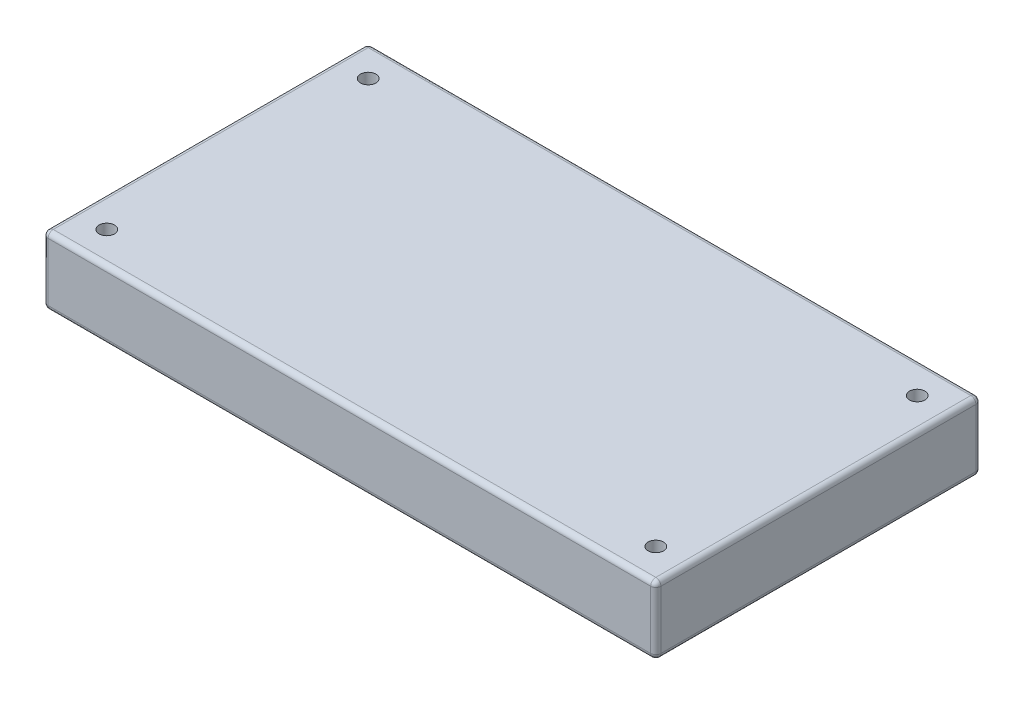
from build123d import *

# Parameters (mm, degrees)
SKETCH_1_W          = 119.1
SKETCH_1_H          = 63.2
EXTRUDE_1_DEPTH     = 13.3
SKETCH_2_R          = 1.5
CUT_EXTRUDE_1_DEPTH = 13.3
SKETCH_3_R          = 1.5
CUT_EXTRUDE_2_DEPTH = 13.3
SKETCH_4_R          = 1.5
CUT_EXTRUDE_3_DEPTH = 13.3
SKETCH_5_R          = 1.5
CUT_EXTRUDE_4_DEPTH = 13.3
SKETCH_7_R          = 0.25
EXTRUDE_4_DEPTH     = 2.65
SKETCH_8_R          = 0.25
EXTRUDE_5_DEPTH     = 2.65
SKETCH_9_R          = 0.25
EXTRUDE_6_DEPTH     = 2.65
SKETCH_10_R         = 1
SKETCH_10_R_2       = 0.5
EXTRUDE_7_DEPTH     = 2.65
FILLET_1_R          = 1
FILLET_2_R          = 1


with BuildPart() as part:
    # 草图1 → 凸台-拉伸1 (new body)
    with BuildSketch(Plane(origin=(0, 0, 0), x_dir=(1, 0, 0), z_dir=(0, 1, 0))):
        Rectangle(SKETCH_1_W, SKETCH_1_H)
    extrude(amount=EXTRUDE_1_DEPTH)

    # 草图2 → 切除-拉伸1 (cut)
    with BuildSketch(Plane(origin=(0, 13.3, 0), x_dir=(1, 0, 0), z_dir=(0, 1, 0))):
        with Locations(Location((-53.35, 25.4, 0), (0, 0, 270))):
            Circle(SKETCH_2_R)
    extrude(amount=-CUT_EXTRUDE_1_DEPTH, mode=Mode.SUBTRACT)

    # 草图3 → 切除-拉伸2 (cut)
    with BuildSketch(Plane(origin=(0, 13.3, 0), x_dir=(1, 0, 0), z_dir=(0, 1, 0))):
        with Locations(Location((53.35, 25.4, 0), (0, 0, 270))):
            Circle(SKETCH_3_R)
    extrude(amount=-CUT_EXTRUDE_2_DEPTH, mode=Mode.SUBTRACT)

    # 草图4 → 切除-拉伸3 (cut)
    with BuildSketch(Plane(origin=(0, 13.3, 0), x_dir=(1, 0, 0), z_dir=(0, 1, 0))):
        with Locations(Location((-53.35, -25.4, 0), (0, 0, 270))):
            Circle(SKETCH_4_R)
    extrude(amount=-CUT_EXTRUDE_3_DEPTH, mode=Mode.SUBTRACT)

    # 草图5 → 切除-拉伸4 (cut)
    with BuildSketch(Plane(origin=(0, 13.3, 0), x_dir=(1, 0, 0), z_dir=(0, 1, 0))):
        with Locations(Location((53.35, -25.4, 0), (0, 0, 270))):
            Circle(SKETCH_5_R)
    extrude(amount=-CUT_EXTRUDE_4_DEPTH, mode=Mode.SUBTRACT)

    # 草图7 → 凸台-拉伸4 (add, symmetric)
    with BuildSketch(Plane(origin=(0, 0, 0), x_dir=(1, 0, 0), z_dir=(0, 1, 0))):
        with Locations(Location((-53.35, 20, 0), (0, 0, 90))):
            Circle(SKETCH_7_R)
    extrude(amount=EXTRUDE_4_DEPTH, both=True)

    # 草图8 → 凸台-拉伸5 (add, symmetric)
    with BuildSketch(Plane(origin=(0, 0, 0), x_dir=(1, 0, 0), z_dir=(0, 1, 0))):
        with Locations(Location((-53.35, 18, 0), (0, 0, 90))):
            Circle(SKETCH_8_R)
        with Locations(Location((-53.35, 16, 0), (0, 0, 90))):
            Circle(SKETCH_8_R)
        with Locations(Location((-53.35, 14, 0), (0, 0, 90))):
            Circle(SKETCH_8_R)
        with Locations(Location((-53.35, 12, 0), (0, 0, 90))):
            Circle(SKETCH_8_R)
    extrude(amount=EXTRUDE_5_DEPTH, both=True)

    # 草图9 → 凸台-拉伸6 (add, symmetric)
    with BuildSketch(Plane(origin=(0, 0, 0), x_dir=(1, 0, 0), z_dir=(0, 1, 0))):
        with Locations(Location((-55.35, 20, 0), (0, 0, 90))):
            Circle(SKETCH_9_R)
        with Locations(Location((-55.35, 18, 0), (0, 0, 90))):
            Circle(SKETCH_9_R)
        with Locations(Location((-55.35, 16, 0), (0, 0, 90))):
            Circle(SKETCH_9_R)
        with Locations(Location((-55.35, 14, 0), (0, 0, 90))):
            Circle(SKETCH_9_R)
        with Locations(Location((-55.35, 12, 0), (0, 0, 90))):
            Circle(SKETCH_9_R)
    extrude(amount=EXTRUDE_6_DEPTH, both=True)

    # 草图10 → 凸台-拉伸7 (add, symmetric)
    with BuildSketch(Plane(origin=(0, 0, 0), x_dir=(1, 0, 0), z_dir=(0, 1, 0))):
        with Locations(Location((-53.35, 8.2, 0), (0, 0, 90))):
            Circle(SKETCH_10_R)
        with Locations(Location((-53.35, 3.1, 0), (0, 0, 90))):
            Circle(SKETCH_10_R)
        with Locations(Location((-53.35, -14, 0), (0, 0, 90))):
            Circle(SKETCH_10_R)
        with Locations(Location((-53.35, -19.1, 0), (0, 0, 90))):
            Circle(SKETCH_10_R)
        with Locations(Location((53.35, 2.5, 0), (0, 0, 90))):
            Circle(SKETCH_10_R)
        with Locations(Location((53.35, 12.7, 0), (0, 0, 90))):
            Circle(SKETCH_10_R)
        with Locations(Location((53.35, -7.6, 0), (0, 0, 90))):
            Circle(SKETCH_10_R_2)
        with Locations(Location((53.35, -11.5, 0), (0, 0, 90))):
            Circle(SKETCH_10_R_2)
    extrude(amount=EXTRUDE_7_DEPTH, both=True)

    # 圆角1
    fillet_1_edges = [part.edges().sort_by_distance(p)[0] for p in [
        (-59.55, 13.3, 0),
        (0, 13.3, -31.6),
        (-59.55, 0, 0),
        (0, 0, -31.6),
        (-59.55, 6.65, -31.6),
        (-59.55, 6.65, 31.6),
        (59.55, 6.65, -31.6),
    ]]
    fillet(fillet_1_edges, radius=FILLET_1_R)

    # 圆角2
    # the kernel refuses this fillet: 1 mm, written as the material it takes off along each edge
    with BuildSketch(Plane(origin=(58.55, 1, -30.6), x_dir=(0, -1, 0), z_dir=(1, 0, 0))) as fillet_2_piece_1_section:
        Polygon((0, 0), (FILLET_2_R, 0), (FILLET_2_R, FILLET_2_R), (0, FILLET_2_R), align=None)
    fillet_2_piece_1 = extrude(amount=FILLET_2_R, mode=Mode.PRIVATE)
    fillet_2_piece_1 = fillet_2_piece_1 - Plane(origin=(58.55, 1, -30.6), x_dir=(0, 0.7071067811865475, 0.7071067811865475), z_dir=(1, 0, 0)) * Sphere(FILLET_2_R, mode=Mode.PRIVATE)
    add(fillet_2_piece_1, mode=Mode.SUBTRACT)
    with BuildSketch(Plane(origin=(58.55, 12.3, -30.6), x_dir=(1, 0, 0), z_dir=(0, 1, 0))) as fillet_2_piece_2_section:
        Polygon((0, 0), (FILLET_2_R, 0), (FILLET_2_R, FILLET_2_R), (0, FILLET_2_R), align=None)
    fillet_2_piece_2 = extrude(amount=FILLET_2_R, mode=Mode.PRIVATE)
    fillet_2_piece_2 = fillet_2_piece_2 - Plane(origin=(58.55, 12.3, -30.6), x_dir=(-0.7071067811865475, 0, 0.7071067811865477), z_dir=(0, 1, 0)) * Sphere(FILLET_2_R, mode=Mode.PRIVATE)
    add(fillet_2_piece_2, mode=Mode.SUBTRACT)
    with BuildSketch(Plane(origin=(-58.55, 1, 30.6), x_dir=(0, 0, 1), z_dir=(0, -1, 0))) as fillet_2_piece_3_section:
        Polygon((0, 0), (FILLET_2_R, 0), (FILLET_2_R, FILLET_2_R), (0, FILLET_2_R), align=None)
    fillet_2_piece_3 = extrude(amount=FILLET_2_R, mode=Mode.PRIVATE)
    fillet_2_piece_3 = fillet_2_piece_3 - Plane(origin=(-58.55, 1, 30.6), x_dir=(0.7071067811865475, 0, -0.7071067811865475), z_dir=(0, -1, 0)) * Sphere(FILLET_2_R, mode=Mode.PRIVATE)
    add(fillet_2_piece_3, mode=Mode.SUBTRACT)
    with BuildSketch(Plane(origin=(-58.55, 12.3, 30.6), x_dir=(0, 0, 1), z_dir=(0, 1, 0))) as fillet_2_piece_4_section:
        Polygon((0, 0), (FILLET_2_R, 0), (FILLET_2_R, -FILLET_2_R), (0, -FILLET_2_R), align=None)
    fillet_2_piece_4 = extrude(amount=FILLET_2_R, mode=Mode.PRIVATE)
    fillet_2_piece_4 = fillet_2_piece_4 - Plane(origin=(-58.55, 12.3, 30.6), x_dir=(0.7071067811865475, 0, -0.7071067811865475), z_dir=(0, 1, 0)) * Sphere(FILLET_2_R, mode=Mode.PRIVATE)
    add(fillet_2_piece_4, mode=Mode.SUBTRACT)
    with BuildSketch(Plane(origin=(58.55, 12.3, 30.6), x_dir=(0, 0, 1), z_dir=(1, 0, 0))) as fillet_2_piece_5_section:
        Polygon((0, 0), (FILLET_2_R, 0), (FILLET_2_R, -FILLET_2_R), (0, -FILLET_2_R), align=None)
    fillet_2_piece_5 = extrude(amount=FILLET_2_R, mode=Mode.PRIVATE)
    fillet_2_piece_5 = fillet_2_piece_5 - Plane(origin=(58.55, 12.3, 30.6), x_dir=(0, -0.7071067811865475, -0.7071067811865475), z_dir=(1, 0, 0)) * Sphere(FILLET_2_R, mode=Mode.PRIVATE)
    add(fillet_2_piece_5, mode=Mode.SUBTRACT)
    with BuildSketch(Plane(origin=(58.55, 1, 30.6), x_dir=(0, -1, 0), z_dir=(1, 0, 0))) as fillet_2_piece_6_section:
        Polygon((0, 0), (FILLET_2_R, 0), (FILLET_2_R, -FILLET_2_R), (0, -FILLET_2_R), align=None)
    fillet_2_piece_6 = extrude(amount=FILLET_2_R, mode=Mode.PRIVATE)
    fillet_2_piece_6 = fillet_2_piece_6 - Plane(origin=(58.55, 1, 30.6), x_dir=(0, 0.7071067811865475, -0.7071067811865475), z_dir=(1, 0, 0)) * Sphere(FILLET_2_R, mode=Mode.PRIVATE)
    add(fillet_2_piece_6, mode=Mode.SUBTRACT)
    with BuildSketch(Plane(origin=(58.55, 13.3, 31.6), x_dir=(0, 0, -1), z_dir=(-1, 0, 0))) as fillet_2_piece_7:
        with BuildLine():
            CenterArc((FILLET_2_R, FILLET_2_R), FILLET_2_R, 180, 90)
            Line((0, FILLET_2_R), (0, 0))
            Line((0, 0), (FILLET_2_R, 0))
        make_face()
    extrude(amount=117.1, mode=Mode.SUBTRACT)
    with BuildSketch(Plane(origin=(59.55, 13.3, -30.6), x_dir=(-1, 0, 0), z_dir=(0, 0, 1)), Plane(origin=(59.55, 0, -30.6), x_dir=(0, 1, 0), z_dir=(0, 0, 1))) as fillet_2_piece_8:
        with BuildLine():
            CenterArc((FILLET_2_R, FILLET_2_R), FILLET_2_R, 180, 90)
            Line((0, FILLET_2_R), (0, 0))
            Line((0, 0), (FILLET_2_R, 0))
        make_face()
    extrude(amount=61.2, mode=Mode.SUBTRACT)
    with BuildSketch(Plane(origin=(58.55, 0, 31.6), x_dir=(0, 0, -1), z_dir=(-1, 0, 0))) as fillet_2_piece_9:
        with BuildLine():
            CenterArc((FILLET_2_R, -FILLET_2_R), FILLET_2_R, 90, 90)
            Line((0, -FILLET_2_R), (0, 0))
            Line((0, 0), (FILLET_2_R, 0))
        make_face()
    extrude(amount=117.1, mode=Mode.SUBTRACT)
    with BuildSketch(Plane(origin=(59.55, 1, 31.6), x_dir=(0, 0, -1), z_dir=(0, 1, 0))) as fillet_2_piece_10:
        with BuildLine():
            CenterArc((FILLET_2_R, FILLET_2_R), FILLET_2_R, 180, 90)
            Line((0, FILLET_2_R), (0, 0))
            Line((0, 0), (FILLET_2_R, 0))
        make_face()
    extrude(amount=11.3, mode=Mode.SUBTRACT)


solid = part.part
